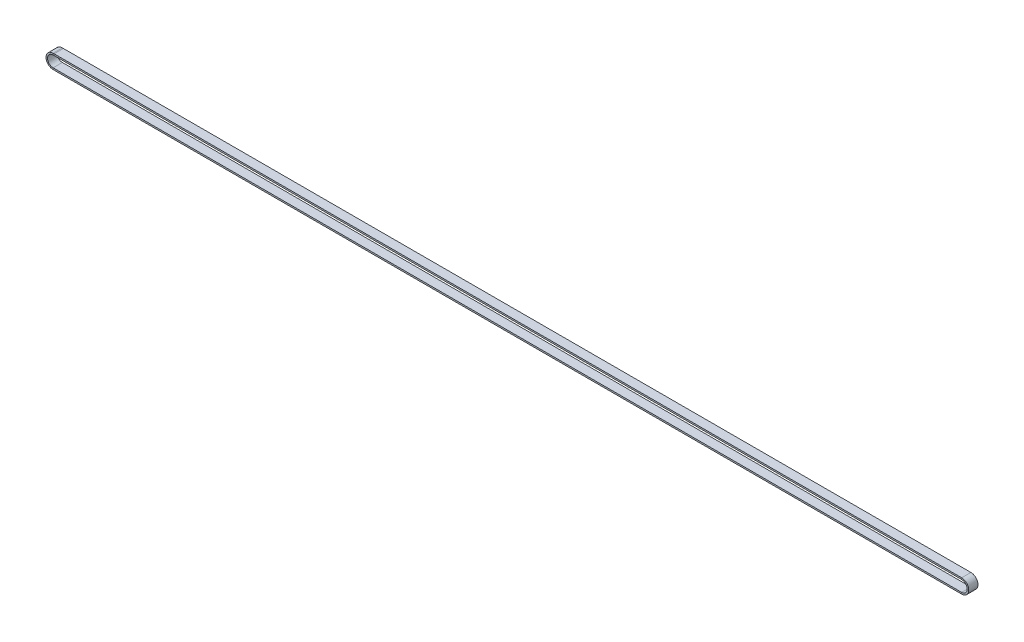
from build123d import *

# Parameters (mm, degrees)
SKETCH3_W = 9
SKETCH3_H = 1.5


with BuildPart() as part:
    # Sweep1: sweep along a path in Sketch2
    with BuildLine(Plane.XY.offset(-113.233366658)) as sweep1_path:
        Line((-1, 79.09175506), (883.520637828, 79.09175506))
        ThreePointArc((883.520637828, 79.09175506), (890.420637828, 72.19175506), (883.520637828, 65.29175506))
        Line((883.520637828, 65.29175506), (-1, 65.29175506))
        ThreePointArc((-1, 65.29175506), (-7.9, 72.19175506), (-1, 79.09175506))
    # Sketch3 → Sweep1 (sweep)
    with BuildSketch(Plane(origin=(0, 0, 0), x_dir=(0, 0, -1), z_dir=(1, 0, 0))):
        with Locations((108.733366658, 78.34175506)):
            Rectangle(SKETCH3_W, SKETCH3_H)
    sweep(path=sweep1_path.line)


solid = part.part
